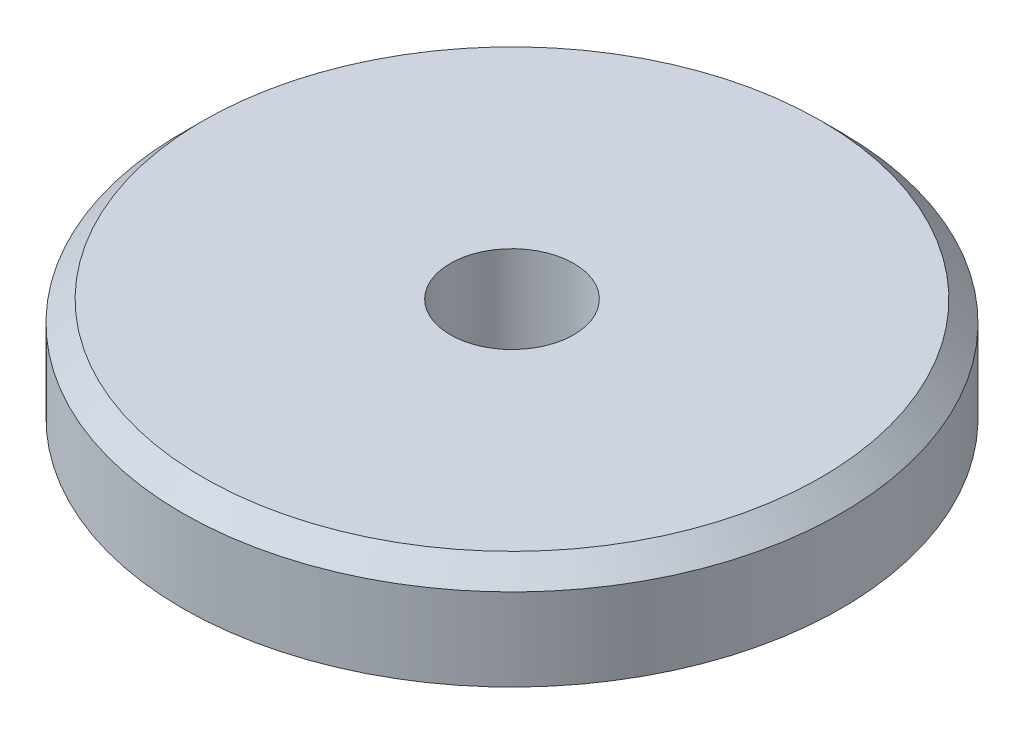
from build123d import *


with BuildPart() as part:
    # Эскиз1 → Повернуть1 (revolve)
    with BuildSketch(Plane.XY):
        Polygon((-3, -1.069151648), (-16, -1.069151648), (-16, 2.930848352), (-15, 3.930848352), (-3, 3.930848352), align=None)
    revolve(axis=Axis((0, 0, 0), (0, 1, 0)))


solid = part.part
